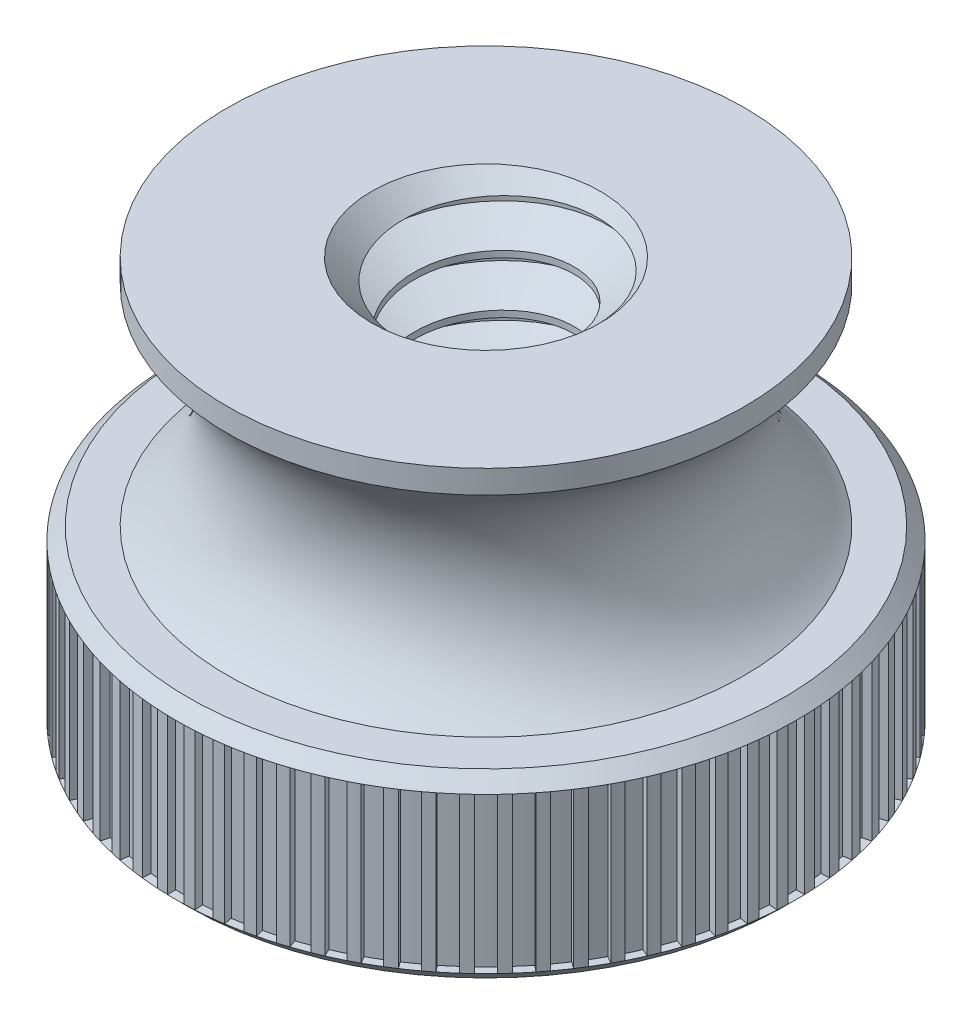
from build123d import *

# Parameters (mm, degrees)
SKETCH3_R               = 1.7526
CUT_EXTRUDE1_DEPTH      = 10.256636133
SWEEP1_PITCH            = 0.79375
SKETCH13_R              = 4.7625
CUT_EXTRUDE2_DEPTH      = 15.37557708
SKETCH14_R              = 4.7625
CUT_EXTRUDE3_DEPTH      = 10.256755123
CHAMFER1_SIZE           = 0.1984375
CUT_EXTRUDE6_REACH      = 21.182
CUT_EXTRUDE6_END_RADIUS = 4.7625
SKETCH17_W              = 0.254
SKETCH17_H              = 2.38125
CIRPATTERN1_COUNT       = 72


with BuildPart() as part:
    # Sketch1 → Revolve1 (revolve)
    with BuildSketch(Plane.XY, mode=Mode.PRIVATE) as revolve1_sk:
        with BuildLine():
            Line((0, 6.35), (-3.96875, 6.35))
            Line((-3.96875, 6.35), (-3.96875, 5.9928125))
            ThreePointArc((-3.96875, 5.9928125), (-3.175, 4.38546875), (-3.96875, 2.778125))
            Line((-3.96875, 2.778125), (-4.7625, 2.778125))
            Line((-4.7625, 2.778125), (-4.7625, 0))
            Line((-4.7625, 0), (0, 0))
            Line((0, 0), (0, 6.35))
        make_face()
    revolve(revolve1_sk.sketch.rotate(Axis((0, 0, 0), (0, 1, 0)), 270), axis=Axis((0, 0, 0), (0, 1, 0)))

    # Sketch3 → Cut-Extrude1 (cut, through all)
    with BuildSketch(Plane(origin=(0, 0, 0), x_dir=(1, 0, 0), z_dir=(0, 1, 0))):
        with Locations(Location((0, 0, 0), (0, 0, 270))):
            Circle(SKETCH3_R)
    extrude(amount=CUT_EXTRUDE1_DEPTH, mode=Mode.SUBTRACT)

    # Sweep1: the profile of Sketch5 profile screwed along a left-hand helix of 16 turns, 6 arcs to a turn; built about Z, then put on its axis
    sweep1_z = Axis((0, 0, 0), (0, 0, 1))
    sweep1_corners = [(1.7529, 0, 0.000173205), (1.7529, 0, -0.694704455), (1.237044252, 0, -0.396875), (1.237044252, 0, -0.29765625)]
    with BuildLine(mode=Mode.PRIVATE) as sweep1_profile:
        Line(sweep1_corners[0], sweep1_corners[1])
        Line(sweep1_corners[1], sweep1_corners[2])
        Line(sweep1_corners[2], sweep1_corners[3])
        Line(sweep1_corners[3], sweep1_corners[0])
    sweep1_cap = Face(sweep1_profile.wire())
    sweep1_turn_angles = [0, -30, -60, -90, -120, -150, -180, -210, -240, -270, -300, -330, -360]
    sweep1_turn_weights = [1, 0.8660254037844387, 1, 0.8660254037844387, 1, 0.8660254037844387, 1, 0.8660254037844387, 1, 0.8660254037844387, 1, 0.8660254037844387, 1]
    sweep1_turn_rails = [Edge.make_bspline([Vector(p[0], p[1], 0).rotate(sweep1_z, sweep1_turn_angles[k]) / sweep1_turn_weights[k] + Vector(0, 0, p[2] + -SWEEP1_PITCH * sweep1_turn_angles[k] / 360) for k in range(13)], [0, 0, 0, 1, 1, 2, 2, 3, 3, 4, 4, 5, 5, 6, 6, 6], 2, sweep1_turn_weights) for p in sweep1_corners]
    sweep1_turn_sides = [Face.make_surface_from_curves(sweep1_turn_rails[p[0]], sweep1_turn_rails[p[1]]) for p in [(0, 1), (1, 2), (2, 3), (3, 0)]]
    sweep1 = Plane(origin=(0, 0, 0), x_dir=(0, 0, 1), z_dir=(0, 1, 0)) * Solid(Shell([*[p.moved(Location((0, 0, SWEEP1_PITCH * i))) for i in range(16) for p in sweep1_turn_sides], sweep1_cap, sweep1_cap.rotate(sweep1_z, -5760).moved(Location((0, 0, -SWEEP1_PITCH * -5760 / 360)))]))
    add(sweep1)

    # Sketch13 → Cut-Extrude2 (cut, through all)
    with BuildSketch(Plane.XZ):
        with Locations(Location((0, 0, 0), (0, 0, 270))):
            Circle(SKETCH13_R)
    extrude(amount=CUT_EXTRUDE2_DEPTH, mode=Mode.SUBTRACT)

    # Sketch14 → Cut-Extrude3 (cut, through all)
    with BuildSketch(Plane(origin=(0, 6.35, 0), x_dir=(1, 0, 0), z_dir=(0, 1, 0))):
        with Locations(Location((0, 0, 0), (0, 0, 90))):
            Circle(SKETCH14_R)
    extrude(amount=CUT_EXTRUDE3_DEPTH, mode=Mode.SUBTRACT)

    # Cut-Extrude4 cone 1 section (through the dimple's axis) → Cut-Extrude4 (revolve, cut)
    with BuildSketch(Plane(origin=(0, 0, 0), x_dir=(0, 0, -1), z_dir=(1, 0, 0))):
        Polygon((0, 0), (1.7526, 0), (0, 1.7526), align=None)
    revolve(axis=Axis((0, 0, 0), (0, 1, 0)), mode=Mode.SUBTRACT)

    # Cut-Extrude5 cone 1 section (through the dimple's axis) → Cut-Extrude5 (revolve, cut)
    with BuildSketch(Plane(origin=(0, 6.35, 0), x_dir=(0, 0, 1), z_dir=(1, 0, 0))):
        Polygon((0, 0), (1.7526, 0), (0, 1.7526), align=None)
    revolve(axis=Axis((0, 6.35, 0), (0, -1, 0)), mode=Mode.SUBTRACT)

    # Chamfer1
    chamfer1_edges = [part.edges().sort_by_distance(p)[0] for p in [
        (0, 0, 4.7625),
        (0, 2.778125, 4.7625),
    ]]
    chamfer(chamfer1_edges, length=CHAMFER1_SIZE)

    # Cut-Extrude6: up to this cylinder (the profile starts outside it)
    cut_extrude6_end = Plane(origin=(0, 1.389063, 0.127), z_dir=(0, -1, 0)) * Cylinder(CUT_EXTRUDE6_END_RADIUS, 52.889, mode=Mode.PRIVATE)
    # Sketch17 → Cut-Extrude6 (cut, up to the surface)
    with BuildSketch(Plane.XY.offset(-12.7), mode=Mode.PRIVATE) as cut_extrude6_sk1:
        with Locations((0, 1.3890625)):
            Rectangle(SKETCH17_W, SKETCH17_H)
    cut_extrude6_tool1 = extrude(cut_extrude6_sk1.sketch, amount=CUT_EXTRUDE6_REACH, mode=Mode.PRIVATE) - cut_extrude6_end
    cut_extrude6 = cut_extrude6_tool1.solids().sort_by_distance((0, 1.389063, -12.7))[0]
    add(cut_extrude6, mode=Mode.SUBTRACT)

    # CirPattern1: Cut-Extrude6 ×72 about axis
    cirpattern1_axis = Axis((0, 0, 0), (0, 1, 0))
    for i in range(1, CIRPATTERN1_COUNT):
        add(cut_extrude6.rotate(cirpattern1_axis, i * 360 / CIRPATTERN1_COUNT), mode=Mode.SUBTRACT)


solid = part.part
